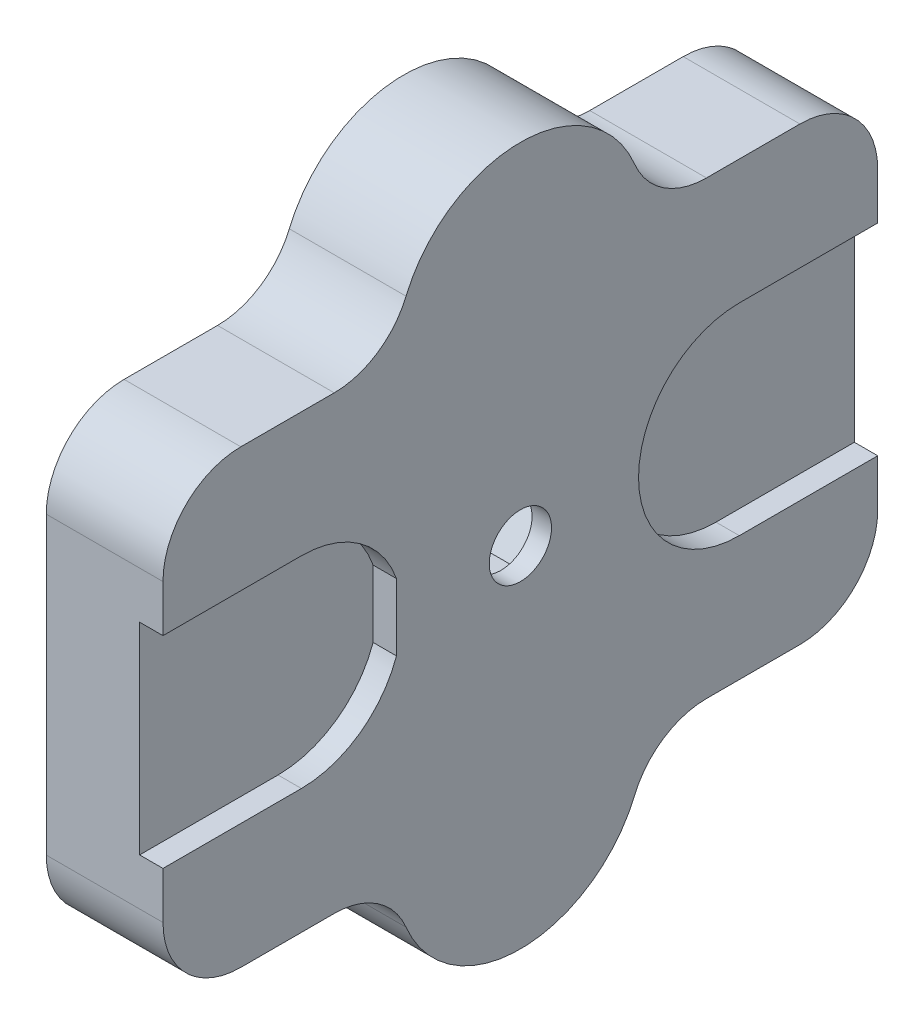
from build123d import *

# Parameters (mm, degrees)
BOSS_EXTRUDE3_DEPTH = 15
SKETCH3_R           = 4
CUT_EXTRUDE3_DEPTH  = 14.0462
CUT_EXTRUDE4_DEPTH  = 3
CUT_EXTRUDE5_START  = -15
CUT_EXTRUDE5_DEPTH  = 12.5
MIRROR1_DEPTH       = 12.5
MIRROR1_START       = 12
MIRROR1_2_DEPTH     = 3
MIRROR1_3_DEPTH     = 12
MIRROR1_4_DEPTH     = 3


# Read off the part's stored shape, not the designer's step: Mirror1
with BuildPart() as part:
    # Sketch1 → Boss-Extrude3 (new body)
    with BuildSketch(Plane.YZ):
        with BuildLine():
            Line((-28.968617751, -12.789334175), (28.968617751, -12.789334175))
            ThreePointArc((28.968617751, -12.789334175), (44.579120821, 0), (35.110840206, 17.821518929))
            ThreePointArc((35.110840206, 17.821518929), (30.644623053, 21.505675602), (28.968617751, 27.047436358))
            Line((28.968617751, 27.047436358), (28.968617751, 39.053986921))
            ThreePointArc((28.968617751, 39.053986921), (26.039685563, 46.125054733), (18.968617751, 49.053986921))
            Line((18.968617751, 49.053986921), (-18.968617751, 49.053986921))
            ThreePointArc((-18.968617751, 49.053986921), (-26.039685563, 46.125054733), (-28.968617751, 39.053986921))
            Line((-28.968617751, 39.053986921), (-28.968617751, 27.047436358))
            ThreePointArc((-28.968617751, 27.047436358), (-30.644623053, 21.505675602), (-35.110840206, 17.821518929))
            ThreePointArc((-35.110840206, 17.821518929), (-44.579120821, 0), (-28.968617751, -12.789334175))
        make_face()
    extrude(amount=BOSS_EXTRUDE3_DEPTH)

    # Sketch3 → Cut-Extrude3 (cut)
    with BuildSketch(Plane.YZ.offset(15)):
        with Locations(Location((0, 3.132326373, 0), (0, 0, 270))):
            Circle(SKETCH3_R)
    extrude(amount=-CUT_EXTRUDE3_DEPTH, mode=Mode.SUBTRACT)

    # Sketch4 → Cut-Extrude4 (cut)
    with BuildSketch(Plane.YZ.offset(15)):
        with BuildLine():
            Line((-12.95, 49.053986921), (-12.95, 31.267703884))
            ThreePointArc((-12.95, 31.267703884), (0, 18.317703884), (12.95, 31.267703884))
            Line((12.95, 31.267703884), (12.95, 49.053986921))
            Line((12.95, 49.053986921), (-12.95, 49.053986921))
        make_face()
    extrude(amount=-CUT_EXTRUDE4_DEPTH, mode=Mode.SUBTRACT)

    # Sketch5 → Cut-Extrude5 (cut, symmetric)
    with BuildSketch(Plane.YZ.offset(15).offset(CUT_EXTRUDE5_START)):
        Polygon((5.466157569, 6.586954394), (-0.258716842, 9.5934717), (-5.724874411, 6.138843679), (-5.466157569, -0.322301647), (0.258716842, -3.328818953), (5.724874411, 0.125809067), align=None)
    extrude(amount=CUT_EXTRUDE5_DEPTH, both=True, mode=Mode.SUBTRACT)

    # Mirror1 outline → Mirror1 (cut)
    with BuildSketch(Plane.YZ):
        Polygon((-2.802243807, -1.721302263), (-0.258716842, -3.328818953), (0, -3.192949306), align=None)
        Polygon((-5.724874411, 0.125809067), (-5.477849424, -0.030311467), (-5.604487603, 3.132326373), align=None)
        Polygon((5.477849424, -0.030311467), (2.802243807, -1.721302263), (5.466157569, -0.322301647), align=None)
        Polygon((-5.466157569, 6.586954394), (-5.477849424, 6.294964213), (-2.802243802, 7.985955012), align=None)
        Polygon((5.477849424, 6.294964213), (5.604487603, 3.132326373), (5.724874411, 6.138843679), align=None)
        Polygon((0.258716842, 9.5934717), (0, 9.457602053), (2.802243802, 7.985955012), align=None)
    extrude(amount=MIRROR1_DEPTH, mode=Mode.SUBTRACT)

    # Mirror1 2 outline → Mirror1 2 (cut)
    with BuildSketch(Plane.YZ.offset(MIRROR1_START)):
        with BuildLine():
            ThreePointArc((4.30437196, -12.789334175), (0, -12.053051137), (-4.30437196, -12.789334175))
            Line((-4.30437196, -12.789334175), (4.30437196, -12.789334175))
        make_face()
    extrude(amount=MIRROR1_2_DEPTH, mode=Mode.SUBTRACT)

    # Mirror1 3 outline → Mirror1 3 (add)
    with BuildSketch(Plane.YZ):
        with BuildLine():
            ThreePointArc((-28.968617751, -32.789334175), (-26.039685563, -39.860401987), (-18.968617751, -42.789334175))
            Line((-18.968617751, -42.789334175), (18.968617751, -42.789334175))
            ThreePointArc((18.968617751, -42.789334175), (26.039685563, -39.860401987), (28.968617751, -32.789334175))
            Line((28.968617751, -32.789334175), (28.968617751, -20.782783611))
            ThreePointArc((28.968617751, -20.782783611), (30.644623053, -15.241022855), (35.110840206, -11.556866182))
            ThreePointArc((35.110840206, -11.556866182), (32.100944124, -12.478176697), (28.968617751, -12.789334175))
            Line((28.968617751, -12.789334175), (-28.968617751, -12.789334175))
            ThreePointArc((-28.968617751, -12.789334175), (-32.100944124, -12.478176697), (-35.110840206, -11.556866182))
            ThreePointArc((-35.110840206, -11.556866182), (-30.644623053, -15.241022855), (-28.968617751, -20.782783611))
            Line((-28.968617751, -20.782783611), (-28.968617751, -32.789334175))
        make_face()
        Polygon((-5.466157569, -0.322301647), (-2.802243807, -1.721302263), (-5.477849424, -0.030311467), align=None)
        Polygon((2.802243807, -1.721302263), (0, -3.192949306), (0.258716842, -3.328818953), align=None)
        Polygon((-5.724874411, 6.138843679), (-5.604487603, 3.132326373), (-5.477849424, 6.294964213), align=None)
        Polygon((5.604487603, 3.132326373), (5.477849424, -0.030311467), (5.724874411, 0.125809067), align=None)
        Polygon((-0.258716842, 9.5934717), (-2.802243802, 7.985955012), (0, 9.457602053), align=None)
        Polygon((2.802243802, 7.985955012), (5.477849424, 6.294964213), (5.466157569, 6.586954394), align=None)
    extrude(amount=MIRROR1_3_DEPTH)

    # Mirror1 4 outline → Mirror1 4 (add)
    with BuildSketch(Plane.YZ.offset(MIRROR1_START)):
        with BuildLine():
            ThreePointArc((-28.968617751, -32.789334175), (-26.039685563, -39.860401987), (-18.968617751, -42.789334175))
            Line((-18.968617751, -42.789334175), (-12.95, -42.789334175))
            Line((-12.95, -42.789334175), (-12.95, -25.003051137))
            ThreePointArc((-12.95, -25.003051137), (-10.569865583, -17.521043281), (-4.30437196, -12.789334175))
            Line((-4.30437196, -12.789334175), (-28.968617751, -12.789334175))
            ThreePointArc((-28.968617751, -12.789334175), (-32.100944124, -12.478176697), (-35.110840206, -11.556866182))
            ThreePointArc((-35.110840206, -11.556866182), (-30.644623053, -15.241022855), (-28.968617751, -20.782783611))
            Line((-28.968617751, -20.782783611), (-28.968617751, -32.789334175))
        make_face()
        with BuildLine():
            Line((12.95, -25.003051137), (12.95, -42.789334175))
            Line((12.95, -42.789334175), (18.968617751, -42.789334175))
            ThreePointArc((18.968617751, -42.789334175), (26.039685563, -39.860401987), (28.968617751, -32.789334175))
            Line((28.968617751, -32.789334175), (28.968617751, -20.782783611))
            ThreePointArc((28.968617751, -20.782783611), (30.644623053, -15.241022855), (35.110840206, -11.556866182))
            ThreePointArc((35.110840206, -11.556866182), (32.100944124, -12.478176697), (28.968617751, -12.789334175))
            Line((28.968617751, -12.789334175), (4.30437196, -12.789334175))
            ThreePointArc((4.30437196, -12.789334175), (10.569865583, -17.521043281), (12.95, -25.003051137))
        make_face()
        with BuildLine():
            ThreePointArc((-4.304371959, 19.053986921), (0, 18.317703884), (4.304371959, 19.053986921))
            Line((4.304371959, 19.053986921), (-4.304371959, 19.053986921))
        make_face()
        Polygon((-5.466157569, -0.322301647), (-2.802243807, -1.721302263), (-5.477849424, -0.030311467), align=None)
        Polygon((2.802243807, -1.721302263), (0, -3.192949306), (0.258716842, -3.328818953), align=None)
        Polygon((-5.724874411, 6.138843679), (-5.604487603, 3.132326373), (-5.477849424, 6.294964213), align=None)
        Polygon((5.604487603, 3.132326373), (5.477849424, -0.030311467), (5.724874411, 0.125809067), align=None)
        Polygon((-0.258716842, 9.5934717), (-2.802243802, 7.985955012), (0, 9.457602053), align=None)
        Polygon((2.802243802, 7.985955012), (5.477849424, 6.294964213), (5.466157569, 6.586954394), align=None)
    extrude(amount=MIRROR1_4_DEPTH)


solid = part.part
